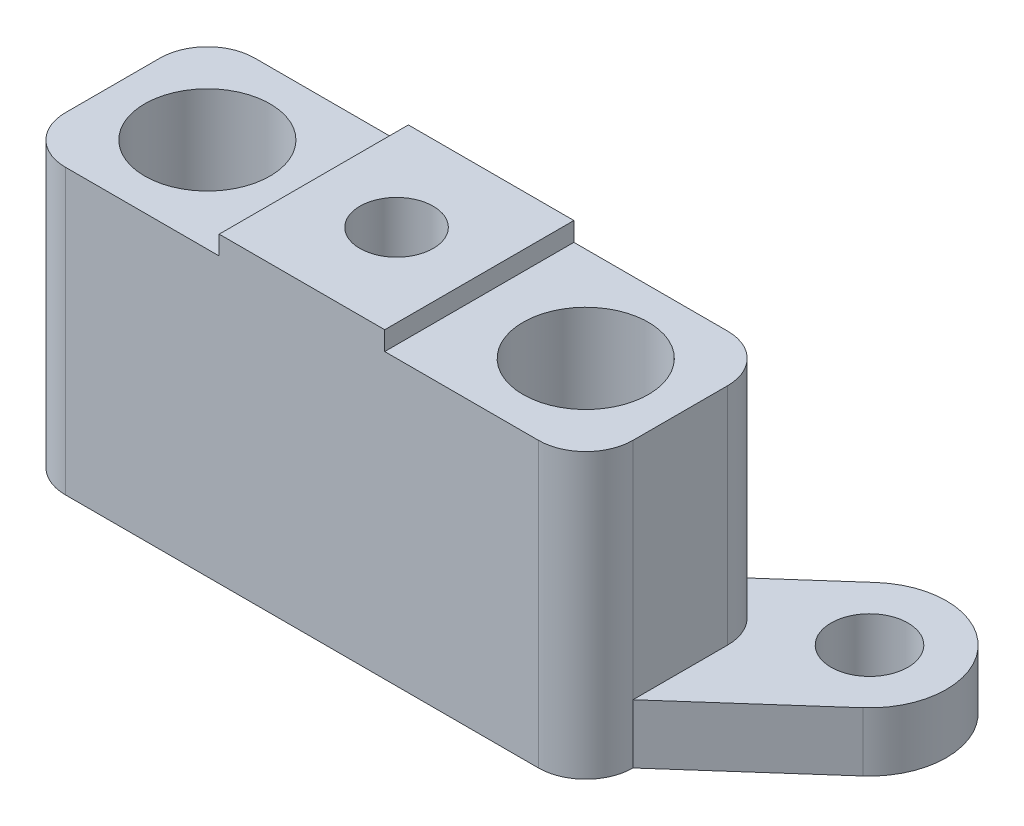
from build123d import *

# Parameters (mm, degrees)
SKETCH25_W          = 7
SKETCH25_H          = 8
BOSS_EXTRUDE5_DEPTH = 12.8
SKETCH26_W          = 24
SKETCH26_H          = 8
SKETCH26_R          = 2.65
BOSS_EXTRUDE6_DEPTH = 12
FILLET1_R           = 2
SKETCH27_R          = 1.55
CUT_EXTRUDE1_DEPTH  = 6.5
SKETCH29_R          = 1.625
BOSS_EXTRUDE8_DEPTH = 2.5


with BuildPart() as part:
    # Sketch25 → Boss-Extrude5 (new body)
    with BuildSketch(Plane(origin=(0, 0, 0), x_dir=(-1, 0, 0), z_dir=(0, 1, 0))):
        Rectangle(SKETCH25_W, SKETCH25_H)
    extrude(amount=BOSS_EXTRUDE5_DEPTH)

    # Sketch26 → Boss-Extrude6 (add)
    with BuildSketch(Plane(origin=(0, 0, 0), x_dir=(-1, 0, 0), z_dir=(0, 1, 0))):
        Rectangle(SKETCH26_W, SKETCH26_H)
        with Locations((-8, 0)):
            Circle(SKETCH26_R, mode=Mode.SUBTRACT)
        with Locations((8, 0)):
            Circle(SKETCH26_R, mode=Mode.SUBTRACT)
    extrude(amount=BOSS_EXTRUDE6_DEPTH)

    # Fillet1
    fillet1_edges = [part.edges().sort_by_distance(p)[0] for p in [
        (12, 6, -4),
        (-12, 6, -4),
        (-12, 6, 4),
        (12, 6, 4),
    ]]
    fillet(fillet1_edges, radius=FILLET1_R)

    # Sketch27 → Cut-Extrude1 (cut)
    with BuildSketch(Plane(origin=(0, 12.8, 0), x_dir=(1, 0, 0), z_dir=(0, 1, 0))):
        Circle(SKETCH27_R)
    extrude(amount=-CUT_EXTRUDE1_DEPTH, mode=Mode.SUBTRACT)

    # Sketch29 → Boss-Extrude8 (add)
    # profile 1 of 2: a face of its own
    with BuildSketch(Plane.XZ):
        with BuildLine():
            Line((-17.155221844, -2.567404924), (-12, 2))
            Line((-12, 2), (-11, -3))
            Line((-11, -3), (-8.970414177, -4))
            Line((-8.970414177, -4), (-12.844778156, -7.432595076))
            ThreePointArc((-12.844778156, -7.432595076), (-17.432595076, -7.155221844), (-17.155221844, -2.567404924))
        make_face()
        with Locations((-15, -5)):
            Circle(SKETCH29_R, mode=Mode.SUBTRACT)
    # profile 2 of 2: a face of its own
    with BuildSketch(Plane.XZ):
        with BuildLine():
            Line((17.155221844, -2.567404924), (12, 2))
            Line((12, 2), (11, -3))
            Line((11, -3), (8.970414177, -4))
            Line((8.970414177, -4), (12.844778156, -7.432595076))
            ThreePointArc((12.844778156, -7.432595076), (17.432595076, -7.155221844), (17.155221844, -2.567404924))
        make_face()
        with Locations((15, -5)):
            Circle(SKETCH29_R, mode=Mode.SUBTRACT)
    extrude(amount=-BOSS_EXTRUDE8_DEPTH)


solid = part.part
